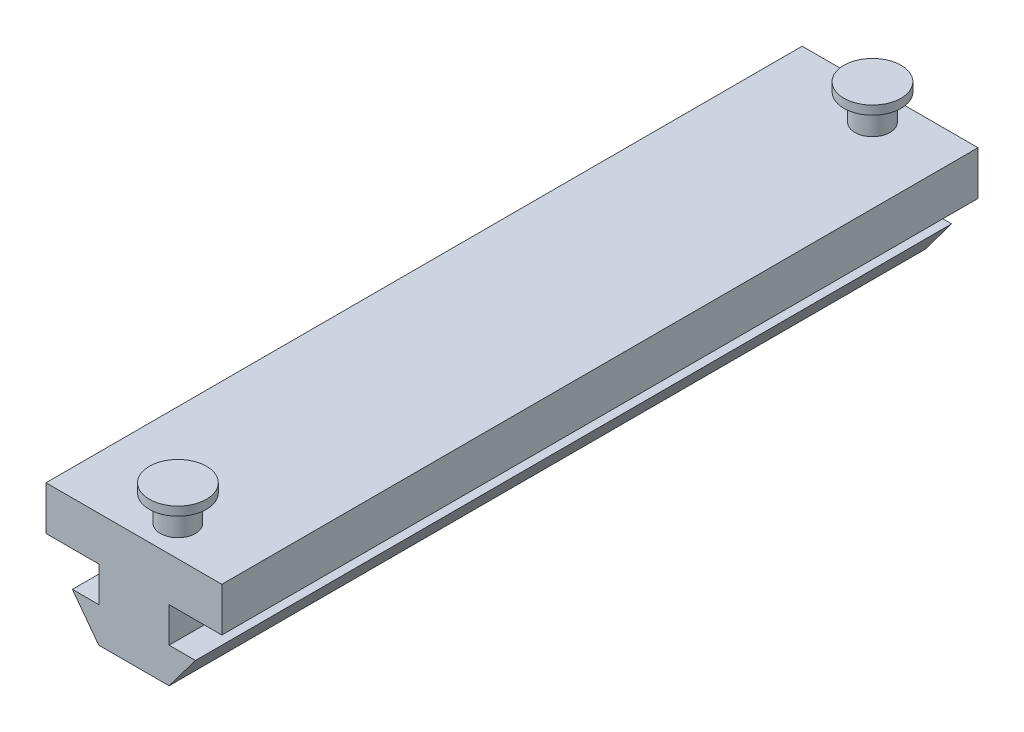
from build123d import *

# Parameters (mm, degrees)
SKETCH1_W           = 20
SKETCH1_H           = 86
BOSS_EXTRUDE1_DEPTH = 5
SKETCH2_R           = 2
BOSS_EXTRUDE2_DEPTH = 3
SKETCH3_R           = 3.25
BOSS_EXTRUDE3_DEPTH = 1
BOSS_EXTRUDE4_DEPTH = 86


with BuildPart() as part:
    # Sketch1 → Boss-Extrude1 (new body)
    with BuildSketch(Plane(origin=(0, 0, 0), x_dir=(1, 0, 0), z_dir=(0, 1, 0))):
        Rectangle(SKETCH1_W, SKETCH1_H)
    extrude(amount=BOSS_EXTRUDE1_DEPTH)

    # Sketch2 → Boss-Extrude2 (add)
    with BuildSketch(Plane(origin=(0, 5, 0), x_dir=(1, 0, 0), z_dir=(0, 1, 0))):
        with Locations((1.5, -39.5)):
            Circle(SKETCH2_R)
        with Locations((1.5, 39.5)):
            Circle(SKETCH2_R)
    extrude(amount=BOSS_EXTRUDE2_DEPTH)

    # Sketch3 → Boss-Extrude3 (add)
    with BuildSketch(Plane(origin=(0, 8, 0), x_dir=(1, 0, 0), z_dir=(0, 1, 0))):
        with Locations((1.5, -39.5)):
            Circle(SKETCH3_R)
        with Locations((1.5, 39.5)):
            Circle(SKETCH3_R)
    extrude(amount=BOSS_EXTRUDE3_DEPTH)

    # Sketch4 → Boss-Extrude4 (add)
    with BuildSketch(Plane.XY.offset(43)):
        Polygon((-4, 0), (-4, -4), (-7, -4), (-4, -8), (4, -8), (7, -4), (4, -4), (4, 0), align=None)
    extrude(amount=-BOSS_EXTRUDE4_DEPTH)


solid = part.part
